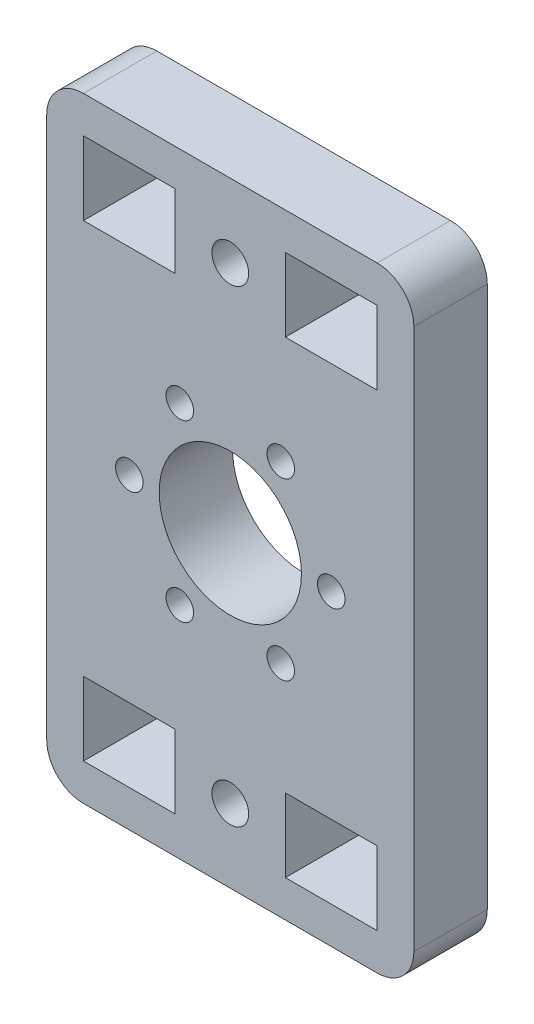
from build123d import *

# Parameters (mm, degrees)
SKETCH1_R           = 7.75
SKETCH1_R_2         = 1.5
SKETCH1_R_3         = 2
SKETCH1_W           = 10
SKETCH1_H           = 8
BOSS_EXTRUDE2_DEPTH = 8


with BuildPart() as part:
    # Sketch1 → Boss-Extrude2 (new body)
    with BuildSketch(Plane.XY):
        with BuildLine():
            Line((16, -33.5), (-16, -33.5))
            ThreePointArc((-16, -33.5), (-18.828427125, -32.328427125), (-20, -29.5))
            Line((-20, -29.5), (-20, 29.5))
            ThreePointArc((-20, 29.5), (-18.828427125, 32.328427125), (-16, 33.5))
            Line((-16, 33.5), (16, 33.5))
            ThreePointArc((16, 33.5), (18.828427125, 32.328427125), (20, 29.5))
            Line((20, 29.5), (20, -29.5))
            ThreePointArc((20, -29.5), (18.828427125, -32.328427125), (16, -33.5))
        make_face()
        Circle(SKETCH1_R, mode=Mode.SUBTRACT)
        with Locations((-11, 0)):
            Circle(SKETCH1_R_2, mode=Mode.SUBTRACT)
        with Locations((-5.5, 9.526279442)):
            Circle(SKETCH1_R_2, mode=Mode.SUBTRACT)
        with Locations((5.5, 9.526279442)):
            Circle(SKETCH1_R_2, mode=Mode.SUBTRACT)
        with Locations((11, 0)):
            Circle(SKETCH1_R_2, mode=Mode.SUBTRACT)
        with Locations((5.5, -9.526279442)):
            Circle(SKETCH1_R_2, mode=Mode.SUBTRACT)
        with Locations((-5.5, -9.526279442)):
            Circle(SKETCH1_R_2, mode=Mode.SUBTRACT)
        with Locations((0, -25.500000979)):
            Circle(SKETCH1_R_3, mode=Mode.SUBTRACT)
        with Locations((0, 25.500000979)):
            Circle(SKETCH1_R_3, mode=Mode.SUBTRACT)
        with Locations((-11, -25.5)):
            Rectangle(SKETCH1_W, SKETCH1_H, mode=Mode.SUBTRACT)
        with Locations((11, -25.5)):
            Rectangle(SKETCH1_W, SKETCH1_H, mode=Mode.SUBTRACT)
        with Locations((11, 25.5)):
            Rectangle(SKETCH1_W, SKETCH1_H, mode=Mode.SUBTRACT)
        with Locations((-11, 25.5)):
            Rectangle(SKETCH1_W, SKETCH1_H, mode=Mode.SUBTRACT)
    extrude(amount=BOSS_EXTRUDE2_DEPTH)


solid = part.part
